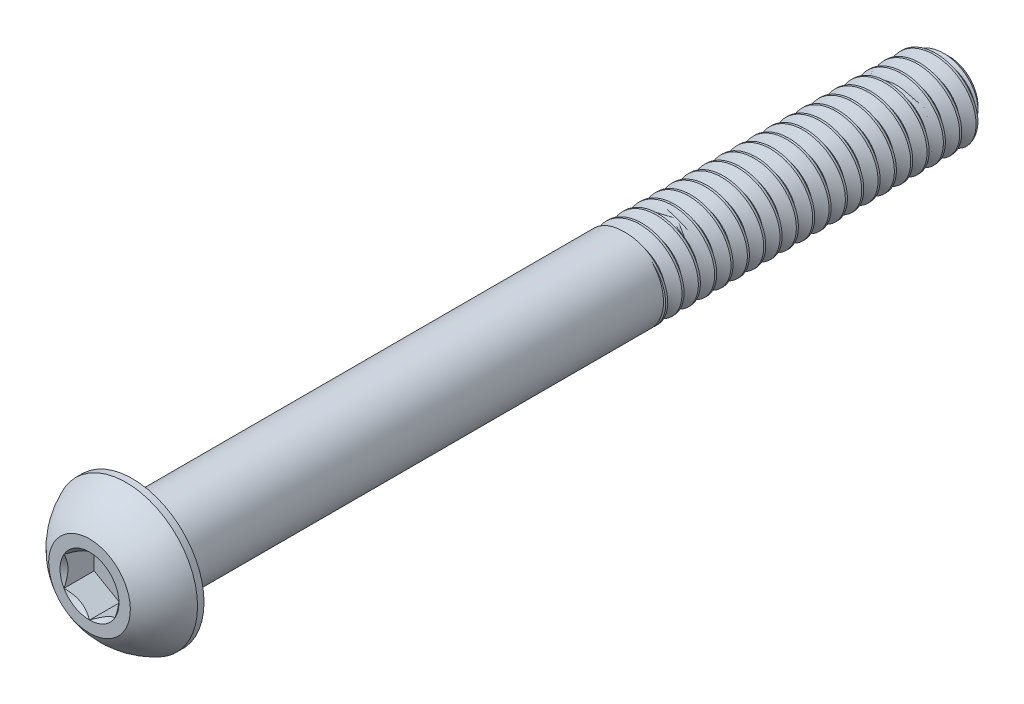
from build123d import *
from build123d.topology import SkipClean

# Parameters (mm, degrees)
SKETCH1_W           = 63.5
SKETCH1_H           = 3.175
CHAMFER1_SIZE       = 0.9525
CUT_SWEEP1_PITCH    = 1.27
CUT_EXTRUDE2_DEPTH  = 2.34696
BOSS_EXTRUDE2_START = -38.1
SKETCH9_R           = 3.175
BOSS_EXTRUDE2_DEPTH = 38.1


with BuildPart() as part:
    # Sketch1 → Revolve1 (revolve)
    with BuildSketch(Plane(origin=(0, 0, 0), x_dir=(0, 0, -1), z_dir=(1, 0, 0))):
        with Locations((35.1028, 1.5875)):
            Rectangle(SKETCH1_W, SKETCH1_H)
    revolve(axis=Axis((0, 0, -66.8528), (0, 0, 1)))

    # Chamfer1
    chamfer1_edges = [part.edges().sort_by_distance(p)[0] for p in [
        (0, -3.175, -66.8528),
    ]]
    chamfer(chamfer1_edges, length=CHAMFER1_SIZE)

    # Cut-Sweep1: the profile of Sketch2 profile screwed along a right-hand helix of 51 turns, 8 arcs to a turn; built about Z, then put on its axis
    cut_sweep1_z = Axis((0, 0, 0), (0, 0, 1))
    cut_sweep1_corners = [(3.1753, 0, 0.000173205), (3.1753, 0, -1.111423205), (2.350110803, 0, -0.635), (2.350110803, 0, -0.47625)]
    with BuildLine(mode=Mode.PRIVATE) as cut_sweep1_profile:
        Line(cut_sweep1_corners[0], cut_sweep1_corners[1])
        Line(cut_sweep1_corners[1], cut_sweep1_corners[2])
        Line(cut_sweep1_corners[2], cut_sweep1_corners[3])
        Line(cut_sweep1_corners[3], cut_sweep1_corners[0])
    cut_sweep1_cap = Face(cut_sweep1_profile.wire())
    cut_sweep1_turn_angles = [0, 22.5, 45, 67.5, 90, 112.5, 135, 157.5, 180, 202.5, 225, 247.5, 270, 292.5, 315, 337.5, 360, 382.5, 405, 427.5, 450, 472.5, 495, 517.5, 540, 562.5, 585, 607.5, 630, 652.5, 675, 697.5, 720]
    cut_sweep1_turn_weights = [1, 0.9238795325112867, 1, 0.9238795325112867, 1, 0.9238795325112867, 1, 0.9238795325112867, 1, 0.9238795325112867, 1, 0.9238795325112867, 1, 0.9238795325112867, 1, 0.9238795325112867, 1, 0.9238795325112867, 1, 0.9238795325112867, 1, 0.9238795325112867, 1, 0.9238795325112867, 1, 0.9238795325112867, 1, 0.9238795325112867, 1, 0.9238795325112867, 1, 0.9238795325112867, 1]
    cut_sweep1_turn_rails = [Edge.make_bspline([Vector(p[0], p[1], 0).rotate(cut_sweep1_z, cut_sweep1_turn_angles[k]) / cut_sweep1_turn_weights[k] + Vector(0, 0, p[2] + CUT_SWEEP1_PITCH * cut_sweep1_turn_angles[k] / 360) for k in range(33)], [0, 0, 0, 1, 1, 2, 2, 3, 3, 4, 4, 5, 5, 6, 6, 7, 7, 8, 8, 9, 9, 10, 10, 11, 11, 12, 12, 13, 13, 14, 14, 15, 15, 16, 16, 16], 2, cut_sweep1_turn_weights) for p in cut_sweep1_corners]
    cut_sweep1_turn_sides = [Face.make_surface_from_curves(cut_sweep1_turn_rails[p[0]], cut_sweep1_turn_rails[p[1]]) for p in [(0, 1), (1, 2), (2, 3), (3, 0)]]
    cut_sweep1_last_angles = [18000, 18022.5, 18045, 18067.5, 18090, 18112.5, 18135, 18157.5, 18180, 18202.5, 18225, 18247.5, 18270, 18292.5, 18315, 18337.5, 18360]
    cut_sweep1_last_weights = [1, 0.9238795325112867, 1, 0.9238795325112867, 1, 0.9238795325112867, 1, 0.9238795325112867, 1, 0.9238795325112867, 1, 0.9238795325112867, 1, 0.9238795325112867, 1, 0.9238795325126232, 1]
    cut_sweep1_last_rails = [Edge.make_bspline([Vector(p[0], p[1], 0).rotate(cut_sweep1_z, cut_sweep1_last_angles[k]) / cut_sweep1_last_weights[k] + Vector(0, 0, p[2] + CUT_SWEEP1_PITCH * cut_sweep1_last_angles[k] / 360) for k in range(17)], [0, 0, 0, 1, 1, 2, 2, 3, 3, 4, 4, 5, 5, 6, 6, 7, 7, 8, 8, 8], 2, cut_sweep1_last_weights) for p in cut_sweep1_corners]
    cut_sweep1_last_sides = [Face.make_surface_from_curves(cut_sweep1_last_rails[p[0]], cut_sweep1_last_rails[p[1]]) for p in [(0, 1), (1, 2), (2, 3), (3, 0)]]
    cut_sweep1 = Plane(origin=(0, 0, -66.8528), x_dir=(0, 1, 0), z_dir=(0, 0, 1)) * Solid(Shell([*[p.moved(Location((0, 0, 2 * CUT_SWEEP1_PITCH * i))) for i in range(25) for p in cut_sweep1_turn_sides], *cut_sweep1_last_sides, cut_sweep1_cap, cut_sweep1_cap.rotate(cut_sweep1_z, 18360).moved(Location((0, 0, CUT_SWEEP1_PITCH * 18360 / 360)))]))
    add(cut_sweep1, mode=Mode.SUBTRACT)

    # Sketch7 → Revolve2 (revolve)
    with BuildSketch(Plane(origin=(0, 0, 0), x_dir=(0, 0, -1), z_dir=(1, 0, 0)), mode=Mode.PRIVATE) as revolve2_sk:
        with BuildLine():
            Line((2.84988, 5.5499), (3.3528, 5.5499))
            Line((3.3528, 5.5499), (3.3528, 0))
            Line((3.3528, 0), (0, 0))
            Line((0, 0), (0, 3.175))
            ThreePointArc((0, 3.175), (1.235921075, 4.58927271), (2.84988, 5.5499))
        make_face()
    revolve(revolve2_sk.sketch.rotate(Axis((0, 0, 0), (0, 0, -1)), 189.052465709), axis=Axis((0, 0, 0), (0, 0, -1)))

    # Sketch5 → Cut-Extrude2 (cut)
    with BuildSketch(Plane.XY):
        Polygon((1.984375, -1.14567944), (1.984375, 1.14567944), (0, 2.291358881), (-1.984375, 1.14567944), (-1.984375, -1.14567944), (0, -2.291358881), align=None)
    extrude(amount=-CUT_EXTRUDE2_DEPTH, mode=Mode.SUBTRACT)

    # Cut-Extrude3 cone 1 section (through the dimple's axis) → Cut-Extrude3 (revolve, cut)
    with BuildSketch(Plane(origin=(0, 0, 0), x_dir=(0, -1, 0), z_dir=(1, 0, 0))):
        Polygon((0, 0), (2.291358881, 0), (0, 2.291358881), align=None)
    revolve(axis=Axis((0, 0, 0), (0, 0, -1)), mode=Mode.SUBTRACT)

    # Sketch9 → Boss-Extrude2 (add)
    with SkipClean():  # the faces are left unmerged after this step: merging them gives an invalid solid
        with BuildSketch(Plane.XY.offset(-3.3528).offset(BOSS_EXTRUDE2_START)):
            with Locations(Location((0, 0, 0), (0, 0, 90))):
                Circle(SKETCH9_R)
        extrude(amount=BOSS_EXTRUDE2_DEPTH)


solid = part.part
